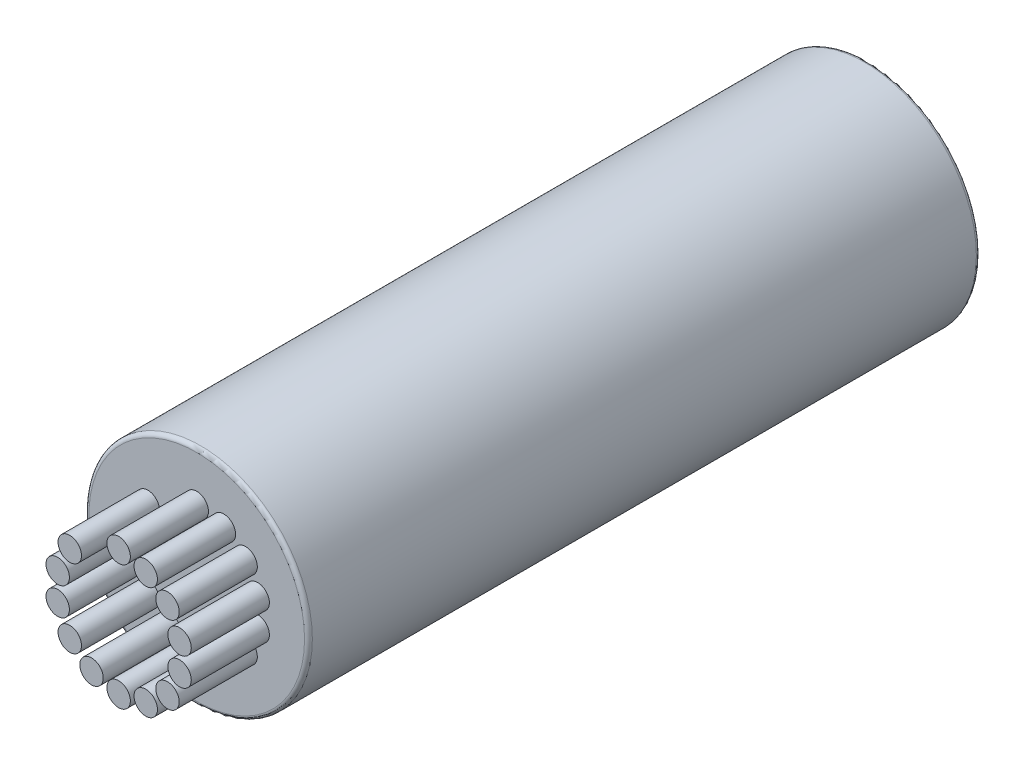
from build123d import *

# Parameters (mm, degrees)
SKETCH1_R           = 7.15
BOSS_EXTRUDE1_DEPTH = 43
SKETCH2_R           = 5
CUT_EXTRUDE1_DEPTH  = 0.1
SKETCH3_R           = 0.75
BOSS_EXTRUDE2_DEPTH = 5
FILLET1_R           = 0.25


with BuildPart() as part:
    # Sketch1 → Boss-Extrude1 (new body)
    with BuildSketch(Plane.XY):
        Circle(SKETCH1_R)
    extrude(amount=BOSS_EXTRUDE1_DEPTH)

    # Sketch2 → Cut-Extrude1 (cut)
    with BuildSketch(Plane(origin=(0, 0, 0), x_dir=(-1, 0, 0), z_dir=(0, 0, -1))):
        Circle(SKETCH2_R)
    extrude(amount=-CUT_EXTRUDE1_DEPTH, mode=Mode.SUBTRACT)

    # Sketch3 → Boss-Extrude2 (add)
    with BuildSketch(Plane.XY.offset(43)):
        with Locations((0, 4)):
            Circle(SKETCH3_R)
        with Locations((1.735534956, 3.603875472)):
            Circle(SKETCH3_R)
        with Locations((3.12732593, 2.493959207)):
            Circle(SKETCH3_R)
        with Locations((3.899711649, 0.890083736)):
            Circle(SKETCH3_R)
        with Locations((3.899711649, -0.890083736)):
            Circle(SKETCH3_R)
        with Locations((3.12732593, -2.493959207)):
            Circle(SKETCH3_R)
        with Locations((1.735534956, -3.603875472)):
            Circle(SKETCH3_R)
        with Locations((0, -4)):
            Circle(SKETCH3_R)
        with Locations((-1.735534956, -3.603875472)):
            Circle(SKETCH3_R)
        with Locations((-3.12732593, -2.493959207)):
            Circle(SKETCH3_R)
        with Locations((-3.899711649, -0.890083736)):
            Circle(SKETCH3_R)
        with Locations((-3.899711649, 0.890083736)):
            Circle(SKETCH3_R)
        with Locations((-3.12732593, 2.493959207)):
            Circle(SKETCH3_R)
    extrude(amount=BOSS_EXTRUDE2_DEPTH)

    # Fillet1
    fillet1_edges = [part.edges().sort_by_distance(p)[0] for p in [
        (-7.15, 0, 43),
        (-7.15, 0, 0),
    ]]
    fillet(fillet1_edges, radius=FILLET1_R)


solid = part.part
